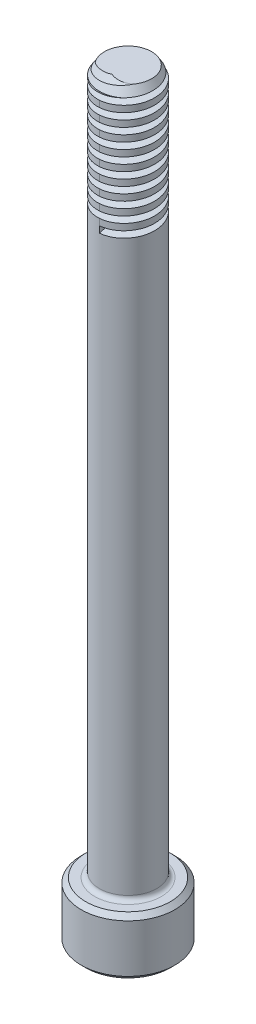
from build123d import *

# Parameters (mm, degrees)
CUT_SWEEP1_PITCH   = 0.635
CUT_EXTRUDE1_DEPTH = 1.2954
FILLET1_R          = 0.2286
FILLET2_R          = 0.396875794
CHAMFER2_SIZE      = 0.2286
CHAMFER3_SIZE      = 0.127


with BuildPart() as part:
    # Sketch1 → Revolve1 (revolve)
    with BuildSketch(Plane.XY, mode=Mode.PRIVATE) as revolve1_sk:
        Polygon((0, 0), (0, 37.7698), (1.4224, 37.7698), (1.4224, 2.8448), (2.3241, 2.8448), (2.3241, 0), align=None)
    revolve(revolve1_sk.sketch.rotate(Axis((0, 0, 0), (0, 1, 0)), 90), axis=Axis((0, 0, 0), (0, 1, 0)))

    # Cut-Sweep1: arcs per turn and ends read off the stored shape
    # Cut-Sweep1: the profile of Sketch3 profile screwed along a right-hand helix through 11 turns, 6 arcs to a turn; built about Z, then put on its axis
    cut_sweep1_z = Axis((0, 0, 0), (0, 0, 1))
    cut_sweep1_corners = [(1.4227, 0, -0.476175), (1.4227, 0, -0.793825), (0.78739873, 0, -0.635)]
    with BuildLine(mode=Mode.PRIVATE) as cut_sweep1_profile:
        Line(cut_sweep1_corners[0], cut_sweep1_corners[1])
        Line(cut_sweep1_corners[1], cut_sweep1_corners[2])
        Line(cut_sweep1_corners[2], cut_sweep1_corners[0])
    cut_sweep1_cap = Face(cut_sweep1_profile.wire())
    cut_sweep1_turn_angles = [0, 30, 60, 90, 120, 150, 180, 210, 240, 270, 300, 330, 360]
    cut_sweep1_turn_weights = [1, 0.8660254037844387, 1, 0.8660254037844387, 1, 0.8660254037844387, 1, 0.8660254037844387, 1, 0.8660254037844387, 1, 0.8660254037844387, 1]
    cut_sweep1_turn_rails = [Edge.make_bspline([Vector(p[0], p[1], 0).rotate(cut_sweep1_z, cut_sweep1_turn_angles[k]) / cut_sweep1_turn_weights[k] + Vector(0, 0, p[2] + CUT_SWEEP1_PITCH * cut_sweep1_turn_angles[k] / 360) for k in range(13)], [0, 0, 0, 1, 1, 2, 2, 3, 3, 4, 4, 5, 5, 6, 6, 6], 2, cut_sweep1_turn_weights) for p in cut_sweep1_corners]
    cut_sweep1_turn_sides = [Face.make_surface_from_curves(cut_sweep1_turn_rails[p[0]], cut_sweep1_turn_rails[p[1]]) for p in [(0, 1), (1, 2), (2, 0)]]
    cut_sweep1 = Plane(origin=(0, 37.7698, 0), x_dir=(0, 0, 1), z_dir=(0, -1, 0)) * Solid(Shell([*[p.moved(Location((0, 0, CUT_SWEEP1_PITCH * i))) for i in range(11) for p in cut_sweep1_turn_sides], cut_sweep1_cap, cut_sweep1_cap.rotate(cut_sweep1_z, 3960).moved(Location((0, 0, CUT_SWEEP1_PITCH * 3960 / 360)))]))
    add(cut_sweep1, mode=Mode.SUBTRACT)

    # Sketch4 → Cut-Extrude1 (cut)
    with BuildSketch(Plane(origin=(0, 0, 0), x_dir=(1, 0, 0), z_dir=(0, 1, 0))):
        Polygon((0, 1.378481503), (-1.1938, 0.689240751), (-1.1938, -0.689240751), (0, -1.378481503), (1.1938, -0.689240751), (1.1938, 0.689240751), align=None)
    extrude(amount=CUT_EXTRUDE1_DEPTH, mode=Mode.SUBTRACT)

    # Fillet1
    fillet1_edges = [part.edges().sort_by_distance(p)[0] for p in [
        (0, 2.8448, 1.4224),
    ]]
    fillet(fillet1_edges, radius=FILLET1_R)

    # Fillet2
    fillet2_edges = [part.edges().sort_by_distance(p)[0] for p in [
        (1.1938, 0.6477, -0.689240751),
        (0, 0.6477, -1.378481503),
        (-1.1938, 0.6477, -0.689240751),
        (-1.1938, 0.6477, 0.689240751),
        (0, 0.6477, 1.378481503),
        (1.1938, 0.6477, 0.689240751),
        (0.5969, 1.2954, -1.033861127),
        (-0.5969, 1.2954, -1.033861127),
        (-1.1938, 1.2954, 0),
        (-0.5969, 1.2954, 1.033861127),
        (0.5969, 1.2954, 1.033861127),
        (1.1938, 1.2954, 0),
    ]]
    fillet(fillet2_edges, radius=FILLET2_R)

    # Chamfer1: read off the stored shape, not the designer's step
    # Chamfer1 outline → Chamfer1 (revolve, cut)
    with BuildSketch(Plane.XY):
        Polygon((1.4224, 37.7698), (1.168399492, 37.7698), (1.4224, 37.358376279), align=None)
    revolve(axis=Axis((0, 0, 0), (0, 1, 0)), mode=Mode.SUBTRACT)

    # Chamfer2
    chamfer2_edges = [part.edges().sort_by_distance(p)[0] for p in [
        (0, 0, 2.3241),
        (0, 2.8448, 2.3241),
    ]]
    chamfer(chamfer2_edges, length=CHAMFER2_SIZE)

    # Chamfer3
    chamfer3_edges = [part.edges().sort_by_distance(p)[0] for p in [
        (0.5969, 0, -1.033861127),
        (-0.5969, 0, -1.033861127),
        (-1.1938, 0, 0),
        (-0.5969, 0, 1.033861127),
        (0.5969, 0, 1.033861127),
        (1.1938, 0, 0),
        (0, 0, -1.317084604),
        (1.140628726, 0, -0.658542302),
        (1.140628726, 0, 0.658542302),
        (0, 0, 1.317084604),
        (-1.140628726, 0, 0.658542302),
        (-1.140628726, 0, -0.658542302),
    ]]
    chamfer(chamfer3_edges, length=CHAMFER3_SIZE)


solid = part.part
